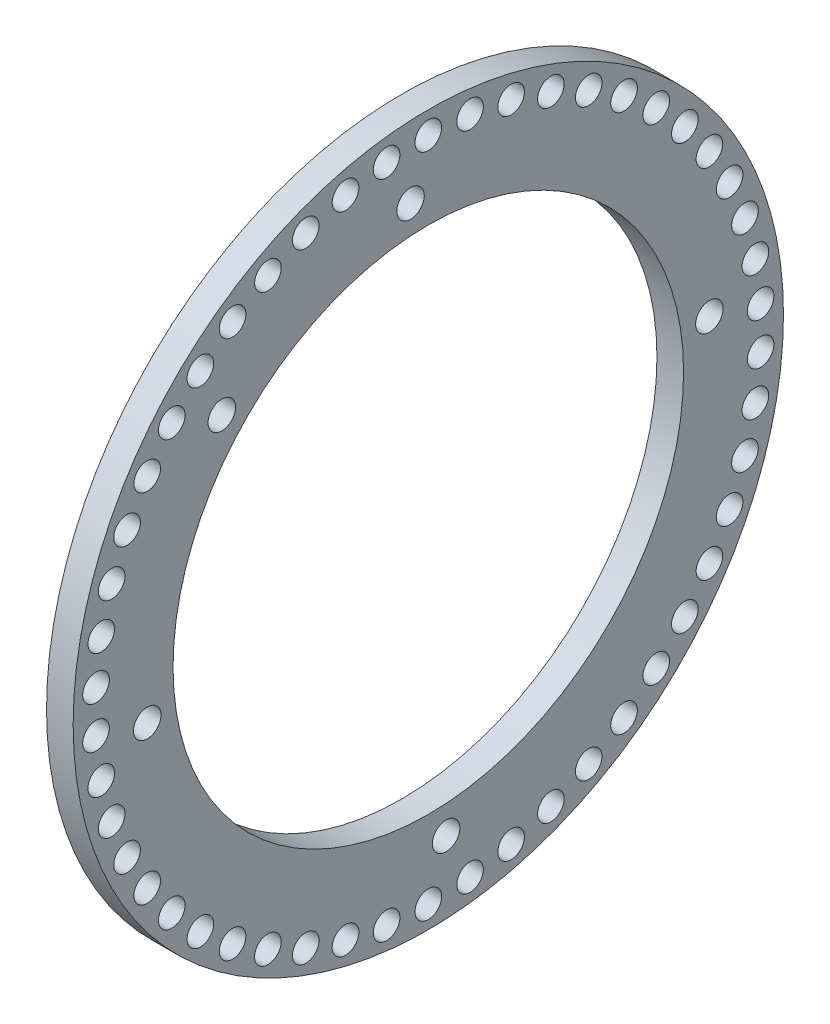
from build123d import *

# Parameters (mm, degrees)
SKETCH1_R           = 40
SKETCH1_R_2         = 1.5
SKETCH1_R_3         = 28.75
SKETCH1_R_4         = 1.55
BOSS_EXTRUDE4_DEPTH = 3


with BuildPart() as part:
    # Sketch1 → Boss-Extrude4 (new body)
    with BuildSketch(Plane(origin=(0, 0, 0), x_dir=(0, 0, -1), z_dir=(1, 0, 0))):
        Circle(SKETCH1_R)
        with Locations((0, 37.5)):
            Circle(SKETCH1_R_2, mode=Mode.SUBTRACT)
        Circle(SKETCH1_R_3, mode=Mode.SUBTRACT)
        with Locations((4.699996259, 37.204301299)):
            Circle(SKETCH1_R_2, mode=Mode.SUBTRACT)
        with Locations((9.325870769, 36.321868542)):
            Circle(SKETCH1_R_2, mode=Mode.SUBTRACT)
        with Locations((13.804670726, 34.866618221)):
            Circle(SKETCH1_R_2, mode=Mode.SUBTRACT)
        with Locations((18.065762779, 32.861500502)):
            Circle(SKETCH1_R_2, mode=Mode.SUBTRACT)
        with Locations((22.041946961, 30.338137289)):
            Circle(SKETCH1_R_2, mode=Mode.SUBTRACT)
        with Locations((25.670516472, 27.336323528)):
            Circle(SKETCH1_R_2, mode=Mode.SUBTRACT)
        with Locations((28.894246604, 23.903399616)):
            Circle(SKETCH1_R_2, mode=Mode.SUBTRACT)
        with Locations((31.662297206, 20.093504812)):
            Circle(SKETCH1_R_2, mode=Mode.SUBTRACT)
        with Locations((33.931014467, 15.966723434)):
            Circle(SKETCH1_R_2, mode=Mode.SUBTRACT)
        with Locations((35.664619361, 11.588137289)):
            Circle(SKETCH1_R_2, mode=Mode.SUBTRACT)
        with Locations((36.835771902, 7.026799297)):
            Circle(SKETCH1_R_2, mode=Mode.SUBTRACT)
        with Locations((37.426002316, 2.354644482)):
            Circle(SKETCH1_R_2, mode=Mode.SUBTRACT)
        with Locations((37.426002316, -2.354644482)):
            Circle(SKETCH1_R_2, mode=Mode.SUBTRACT)
        with Locations((36.835771902, -7.026799297)):
            Circle(SKETCH1_R_2, mode=Mode.SUBTRACT)
        with Locations((35.664619361, -11.588137289)):
            Circle(SKETCH1_R_2, mode=Mode.SUBTRACT)
        with Locations((33.931014467, -15.966723434)):
            Circle(SKETCH1_R_2, mode=Mode.SUBTRACT)
        with Locations((31.662297206, -20.093504812)):
            Circle(SKETCH1_R_2, mode=Mode.SUBTRACT)
        with Locations((28.894246604, -23.903399616)):
            Circle(SKETCH1_R_2, mode=Mode.SUBTRACT)
        with Locations((25.670516472, -27.336323528)):
            Circle(SKETCH1_R_2, mode=Mode.SUBTRACT)
        with Locations((22.041946961, -30.338137289)):
            Circle(SKETCH1_R_2, mode=Mode.SUBTRACT)
        with Locations((18.065762779, -32.861500502)):
            Circle(SKETCH1_R_2, mode=Mode.SUBTRACT)
        with Locations((13.804670726, -34.866618221)):
            Circle(SKETCH1_R_2, mode=Mode.SUBTRACT)
        with Locations((9.325870769, -36.321868542)):
            Circle(SKETCH1_R_2, mode=Mode.SUBTRACT)
        with Locations((4.699996259, -37.204301299)):
            Circle(SKETCH1_R_2, mode=Mode.SUBTRACT)
        with Locations((0, -37.5)):
            Circle(SKETCH1_R_2, mode=Mode.SUBTRACT)
        with Locations((-4.699996259, -37.204301299)):
            Circle(SKETCH1_R_2, mode=Mode.SUBTRACT)
        with Locations((-9.325870769, -36.321868542)):
            Circle(SKETCH1_R_2, mode=Mode.SUBTRACT)
        with Locations((-13.804670726, -34.866618221)):
            Circle(SKETCH1_R_2, mode=Mode.SUBTRACT)
        with Locations((-18.065762779, -32.861500502)):
            Circle(SKETCH1_R_2, mode=Mode.SUBTRACT)
        with Locations((-22.041946961, -30.338137289)):
            Circle(SKETCH1_R_2, mode=Mode.SUBTRACT)
        with Locations((-25.670516472, -27.336323528)):
            Circle(SKETCH1_R_2, mode=Mode.SUBTRACT)
        with Locations((-28.894246604, -23.903399616)):
            Circle(SKETCH1_R_2, mode=Mode.SUBTRACT)
        with Locations((-31.662297206, -20.093504812)):
            Circle(SKETCH1_R_2, mode=Mode.SUBTRACT)
        with Locations((-33.931014467, -15.966723434)):
            Circle(SKETCH1_R_2, mode=Mode.SUBTRACT)
        with Locations((-35.664619361, -11.588137289)):
            Circle(SKETCH1_R_2, mode=Mode.SUBTRACT)
        with Locations((-36.835771902, -7.026799297)):
            Circle(SKETCH1_R_2, mode=Mode.SUBTRACT)
        with Locations((-37.426002316, -2.354644482)):
            Circle(SKETCH1_R_2, mode=Mode.SUBTRACT)
        with Locations((-37.426002316, 2.354644482)):
            Circle(SKETCH1_R_2, mode=Mode.SUBTRACT)
        with Locations((-36.835771902, 7.026799297)):
            Circle(SKETCH1_R_2, mode=Mode.SUBTRACT)
        with Locations((-35.664619361, 11.588137289)):
            Circle(SKETCH1_R_2, mode=Mode.SUBTRACT)
        with Locations((-33.931014467, 15.966723434)):
            Circle(SKETCH1_R_2, mode=Mode.SUBTRACT)
        with Locations((-31.662297206, 20.093504812)):
            Circle(SKETCH1_R_2, mode=Mode.SUBTRACT)
        with Locations((-28.894246604, 23.903399616)):
            Circle(SKETCH1_R_2, mode=Mode.SUBTRACT)
        with Locations((-25.670516472, 27.336323528)):
            Circle(SKETCH1_R_2, mode=Mode.SUBTRACT)
        with Locations((-22.041946961, 30.338137289)):
            Circle(SKETCH1_R_2, mode=Mode.SUBTRACT)
        with Locations((-18.065762779, 32.861500502)):
            Circle(SKETCH1_R_2, mode=Mode.SUBTRACT)
        with Locations((-13.804670726, 34.866618221)):
            Circle(SKETCH1_R_2, mode=Mode.SUBTRACT)
        with Locations((-9.325870769, 36.321868542)):
            Circle(SKETCH1_R_2, mode=Mode.SUBTRACT)
        with Locations((-4.699996259, 37.204301299)):
            Circle(SKETCH1_R_2, mode=Mode.SUBTRACT)
        with Locations((-2.003478367, 31.844376742)):
            Circle(SKETCH1_R_4, mode=Mode.SUBTRACT)
        with Locations((-31.655739691, -3.999049919)):
            Circle(SKETCH1_R_4, mode=Mode.SUBTRACT)
        with Locations((2.003478367, -31.844376742)):
            Circle(SKETCH1_R_4, mode=Mode.SUBTRACT)
        with Locations((31.655739691, 3.999049919)):
            Circle(SKETCH1_R_4, mode=Mode.SUBTRACT)
        with Locations((-23.259448814, 21.842076287)):
            Circle(SKETCH1_R_4, mode=Mode.SUBTRACT)
    extrude(amount=BOSS_EXTRUDE4_DEPTH)


solid = part.part
